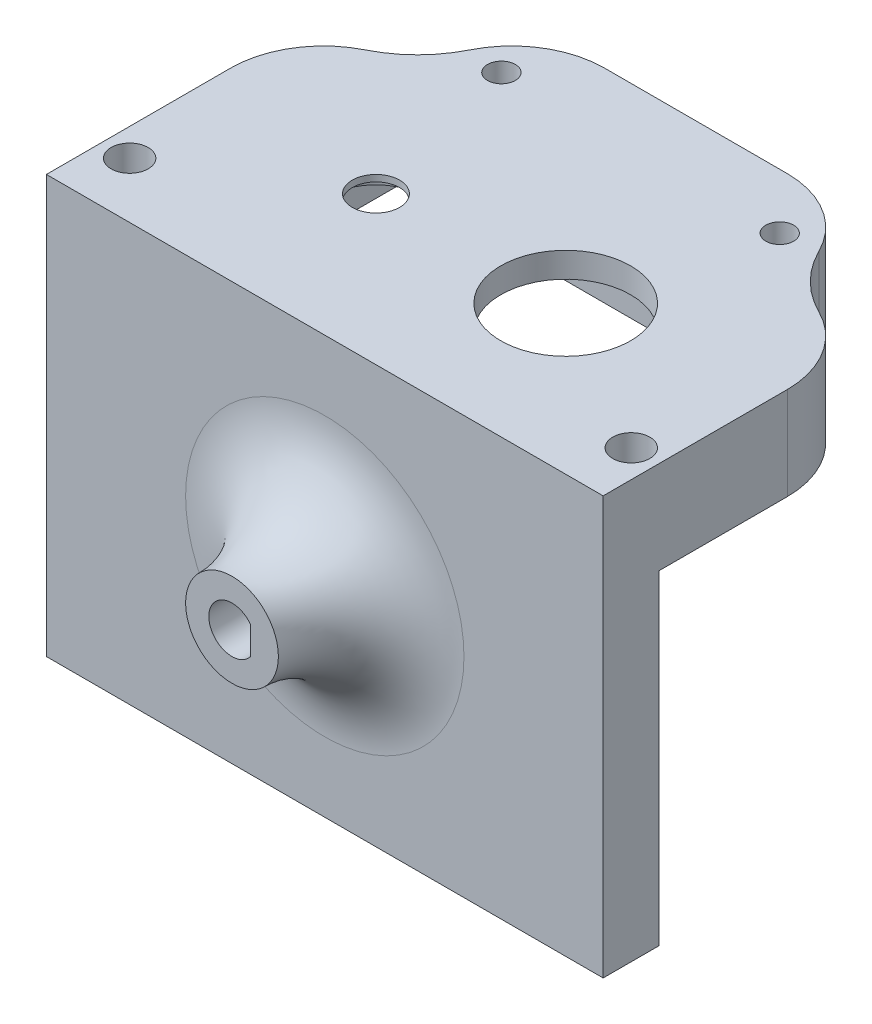
from build123d import *

# Parameters (mm, degrees)
SKETCH_4_W           = 60
SKETCH_4_H           = 40
EXTRUDE_2_DEPTH      = 45
SKETCH_5_W           = 34
SKETCH_5_H           = 35
CUT_EXTRUDE_2_DEPTH  = 78.620873481
F_3_0MM_1_D          = 3
F_3_0MM_1_DEPTH      = 6
F_3_0MM_1_TIP        = 0.901290929
CUT_EXTRUDE_3_DEPTH  = 7.3
SKETCH_9_R           = 7
CUT_EXTRUDE_4_DEPTH  = 8.3
SKETCH_10_R          = 2.550838559
CUT_EXTRUDE_5_DEPTH  = 8.3
SKETCH_11_R          = 5
CUT_EXTRUDE_6_DEPTH  = 2
CUT_EXTRUDE_7_DEPTH  = 3
SKETCH_14_W          = 52.283643435
SKETCH_14_H          = 5.439682323
CUT_EXTRUDE_8_DEPTH  = 3
SKETCH_15_R          = 5
EXTRUDE_3_DEPTH      = 10
FILLET_1_R           = 10
F_3_0MM_2_D          = 3
SKETCH_18_R          = 2
CUT_EXTRUDE_9_DEPTH  = 8
CUT_EXTRUDE_10_DEPTH = 10
FILLET_2_R           = 10


with BuildPart() as part:
    # 草图4 → 凸台-拉伸2 (new body)
    with BuildSketch(Plane(origin=(0, 0, 0), x_dir=(1, 0, 0), z_dir=(0, 1, 0))):
        Rectangle(SKETCH_4_W, SKETCH_4_H)
    extrude(amount=EXTRUDE_2_DEPTH)

    # 草图5 → 切除-拉伸2 (cut, through all)
    with BuildSketch(Plane(origin=(30, 0, 0), x_dir=(0, 0, -1), z_dir=(1, 0, 0))):
        with Locations((3, 17.5)):
            Rectangle(SKETCH_5_W, SKETCH_5_H)
    extrude(amount=-CUT_EXTRUDE_2_DEPTH, mode=Mode.SUBTRACT)

    # Ø3.0mm 暗销孔1
    with Locations(Plane.XZ.offset(-35)):
        with Locations((24.25, -2.063956798), (-24.25, 7.936043202), (-24.25, -2.063956798), (24.25, 7.936043202)):
            Hole(F_3_0MM_1_D / 2, depth=F_3_0MM_1_DEPTH)
            with Locations((0, 0, -(F_3_0MM_1_DEPTH + F_3_0MM_1_TIP / 2))):  # 118° drill point
                Cone(0, F_3_0MM_1_D / 2, F_3_0MM_1_TIP, mode=Mode.SUBTRACT)

    # 草图8 → 切除-拉伸3 (cut)
    with BuildSketch(Plane.XZ.offset(-35)):
        Polygon((-20, -2.063956798), (-20, 14), (20, 14), (20, -8.063956798), (-20, -8.063956798), align=None)
    extrude(amount=-CUT_EXTRUDE_3_DEPTH, mode=Mode.SUBTRACT)

    # 草图9 → 切除-拉伸4 (cut)
    with BuildSketch(Plane.XZ.offset(-42.3)):
        with Locations(Location((10.009015473, 4.047123648, 0), (0, 0, 270))):
            Circle(SKETCH_9_R)
    extrude(amount=-CUT_EXTRUDE_4_DEPTH, mode=Mode.SUBTRACT)

    # 草图10 → 切除-拉伸5 (cut)
    with BuildSketch(Plane.XZ.offset(-42.3)):
        with Locations(Location((-10.440145967, 4.047123648, 0), (0, 0, 270))):
            Circle(SKETCH_10_R)
    extrude(amount=-CUT_EXTRUDE_5_DEPTH, mode=Mode.SUBTRACT)

    # 草图11 → 切除-拉伸6 (cut)
    with BuildSketch(Plane.XZ.offset(-42.3)):
        with Locations(Location((-10.440145967, 4.047123648, 0), (0, 0, 270))):
            Circle(SKETCH_11_R)
    extrude(amount=-CUT_EXTRUDE_6_DEPTH, mode=Mode.SUBTRACT)

    # 草图13 → 切除-拉伸7 (cut)
    with BuildSketch(Plane.XZ.offset(-35)):
        Polygon((-20, 4.395263317), (-27, 4.395263317), (-27, 2.895263317), (-20, 2.968021601), align=None)
        Polygon((20, 2.968021601), (20, 4.395263317), (27, 4.395263317), (27, 2.895263317), align=None)
    extrude(amount=-CUT_EXTRUDE_7_DEPTH, mode=Mode.SUBTRACT)

    # 草图14 → 切除-拉伸8 (cut)
    with BuildSketch(Plane(origin=(0, 0, 14), x_dir=(-1, 0, 0), z_dir=(0, 0, -1))):
        with Locations((0.858178282, 6.724921265)):
            Rectangle(SKETCH_14_W, SKETCH_14_H)
    extrude(amount=-CUT_EXTRUDE_8_DEPTH, mode=Mode.SUBTRACT)

    # 草图15 → 凸台-拉伸3 (add)
    with BuildSketch(Plane.XY.offset(20)):
        with Locations(Location((0, 22.5, 0), (0, 0, 180))):
            Circle(SKETCH_15_R)
        with BuildLine():
            Line((2, 24), (2, 21))
            ThreePointArc((2, 21), (-2.5, 22.5), (2, 24))
        make_face(mode=Mode.SUBTRACT)
    extrude(amount=EXTRUDE_3_DEPTH)

    # 圆角1
    fillet_1_edges = [part.edges().sort_by_distance(p)[0] for p in [
        (5, 22.5, 20),
    ]]
    fillet(fillet_1_edges, radius=FILLET_1_R - 0.0001)  # a hair under: the kernel refuses the full size

    # Ø3.0mm 暗销孔2 (through all)
    with Locations(Plane.XZ.offset(-35)):
        with Locations((15, -14.031978399), (-15, -14.031978399)):
            Hole(F_3_0MM_2_D / 2)

    # 草图18 → 切除-拉伸9 (cut)
    with BuildSketch(Plane(origin=(0, 45, 0), x_dir=(1, 0, 0), z_dir=(0, 1, 0))):
        with Locations(Location((-27.03202133, -14, 0), (0, 0, 270))):
            Circle(SKETCH_18_R)
        with Locations(Location((27.03202133, -14, 0), (0, 0, 90))):
            Circle(SKETCH_18_R)
    extrude(amount=-CUT_EXTRUDE_9_DEPTH, mode=Mode.SUBTRACT)

    # 草图20 → 切除-拉伸10 (cut)
    with BuildSketch(Plane.XZ.offset(-35)):
        with BuildLine():
            Line((-30, -7.5), (-30, -20))
            Line((-30, -20), (-17.5, -20))
            ThreePointArc((-17.5, -20), (-21.161165235, -11.161165235), (-30, -7.5))
        make_face()
        with BuildLine():
            Line((30, -20), (17.5, -20))
            ThreePointArc((17.5, -20), (21.161165235, -11.161165235), (30, -7.5))
            Line((30, -7.5), (30, -20))
        make_face()
    extrude(amount=-CUT_EXTRUDE_10_DEPTH, mode=Mode.SUBTRACT)

    # 圆角2
    fillet_2_edges = [part.edges().sort_by_distance(p)[0] for p in [
        (-17.5, 40, -20),
        (-30, 40, -7.5),
        (30, 40, -7.5),
        (17.5, 40, -20),
    ]]
    fillet(fillet_2_edges, radius=FILLET_2_R)


solid = part.part
